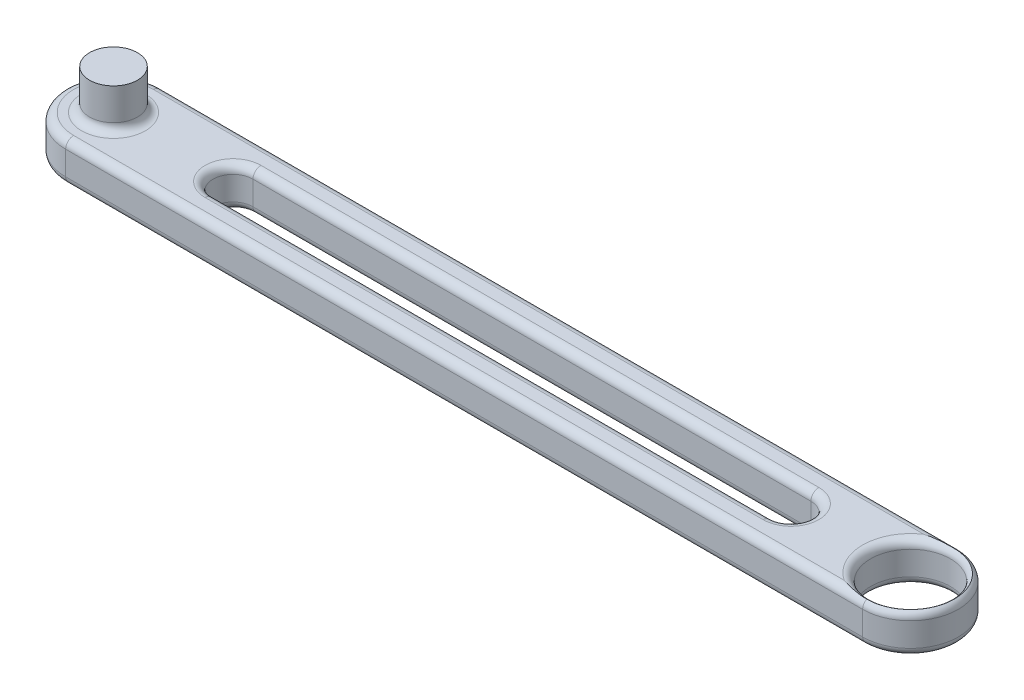
from build123d import *

# Parameters (mm, degrees)
SKETCH_1_R          = 6
EXTRUDE_1_DEPTH     = 5
EXTRUDE_1_2_DEPTH   = 5
SKETCH_3_W          = 100
SKETCH_3_H          = 12
EXTRUDE_3_DEPTH     = 5
SKETCH_5_R          = 5
CUT_EXTRUDE_2_DEPTH = 67.460514593
SKETCH_6_R          = 2.5
CUT_EXTRUDE_3_DEPTH = 67.460514593
SKETCH_7_W          = 70
SKETCH_7_H          = 5
CUT_EXTRUDE_4_DEPTH = 67.460514593
SKETCH_4_R          = 3
EXTRUDE_4_DEPTH     = 5
FILLET_1_R          = 1
FILLET_2_R          = 1


with BuildPart() as part:
    # 草图1 → 凸台-拉伸1 (new body)
    with BuildSketch(Plane(origin=(0, 0, 0), x_dir=(1, 0, 0), z_dir=(0, 1, 0))):
        with Locations(Location((-40, 0, 0), (0, 0, 270))):
            Circle(SKETCH_1_R)
    extrude(amount=EXTRUDE_1_DEPTH)



with BuildPart() as body_2:
    # 草图1 → Extrude 1 2 (new body)
    with BuildSketch(Plane(origin=(0, 0, 0), x_dir=(1, 0, 0), z_dir=(0, 1, 0))):
        with Locations(Location((60, 0, 0), (0, 0, 270))):
            Circle(SKETCH_1_R)
    extrude(amount=EXTRUDE_1_2_DEPTH)


with BuildPart() as part_1:
    add(part.part)

    add(body_2.part)  # 凸台-拉伸3 merges body 2
    # 草图3 → 凸台-拉伸3 (add)
    with BuildSketch(Plane(origin=(0, 0, 0), x_dir=(1, 0, 0), z_dir=(0, 1, 0))):
        with Locations((10, 0)):
            Rectangle(SKETCH_3_W, SKETCH_3_H)
    extrude(amount=EXTRUDE_3_DEPTH)

    # 草图5 → 切除-拉伸2 (cut, through all)
    with BuildSketch(Plane(origin=(0, 5, 0), x_dir=(1, 0, 0), z_dir=(0, 1, 0))):
        with Locations(Location((60, 0, 0), (0, 0, 270))):
            Circle(SKETCH_5_R)
    extrude(amount=-CUT_EXTRUDE_2_DEPTH, mode=Mode.SUBTRACT)

    # 草图6 → 切除-拉伸3 (cut, through all)
    with BuildSketch(Plane(origin=(0, 5, 0), x_dir=(1, 0, 0), z_dir=(0, 1, 0))):
        with Locations(Location((-25, 0, 0), (0, 0, 270))):
            Circle(SKETCH_6_R)
        with Locations(Location((45, 0, 0), (0, 0, 270))):
            Circle(SKETCH_6_R)
    extrude(amount=-CUT_EXTRUDE_3_DEPTH, mode=Mode.SUBTRACT)

    # 草图7 → 切除-拉伸4 (cut, through all)
    with BuildSketch(Plane(origin=(0, 5, 0), x_dir=(1, 0, 0), z_dir=(0, 1, 0))):
        with Locations((10, 0)):
            Rectangle(SKETCH_7_W, SKETCH_7_H)
    extrude(amount=-CUT_EXTRUDE_4_DEPTH, mode=Mode.SUBTRACT)

    # 草图4 → 凸台-拉伸4 (add)
    with BuildSketch(Plane(origin=(0, 5, 0), x_dir=(1, 0, 0), z_dir=(0, 1, 0))):
        with Locations(Location((-40, 0, 0), (0, 0, 270))):
            Circle(SKETCH_4_R)
    extrude(amount=EXTRUDE_4_DEPTH)

    # 圆角1
    fillet_1_edges = [part_1.edges().sort_by_distance(p)[0] for p in [
        (-40, 5, -3),
    ]]
    fillet(fillet_1_edges, radius=FILLET_1_R)

    # 圆角2
    # the kernel refuses this fillet: 1 mm, written as the material it takes off along each edge
    with BuildSketch(Plane(origin=(-40, 5, 0), x_dir=(0, 0, -1), z_dir=(1, 0, 0))) as fillet_2_piece_1:
        with BuildLine():
            CenterArc((6 - FILLET_2_R, -FILLET_2_R), FILLET_2_R, 0, 90)
            Line((6, -FILLET_2_R), (6, 0))
            Line((6, 0), (6 - FILLET_2_R, 0))
        make_face()
    revolve(axis=Axis((-40, 5, 0), (0, 1, 0)), revolution_arc=180, mode=Mode.SUBTRACT)
    with BuildSketch(Plane(origin=(-40, 0, -6), x_dir=(0, 1, 0), z_dir=(1, 0, 0)), Plane(origin=(-40, 5, -6), x_dir=(0, 0, 1), z_dir=(1, 0, 0)), Plane(origin=(60, 0, 6), x_dir=(0, 1, 0), z_dir=(-1, 0, 0)), Plane(origin=(60, 5, 6), x_dir=(0, 0, -1), z_dir=(-1, 0, 0))) as fillet_2_piece_2:
        with BuildLine():
            CenterArc((FILLET_2_R, FILLET_2_R), FILLET_2_R, 180, 90)
            Line((0, FILLET_2_R), (0, 0))
            Line((0, 0), (FILLET_2_R, 0))
        make_face()
    extrude(amount=100, mode=Mode.SUBTRACT)
    with BuildSketch(Plane(origin=(60, 5, 0), x_dir=(0, 0, 1), z_dir=(-1, 0, 0))) as fillet_2_piece_3:
        with BuildLine():
            CenterArc((6 - FILLET_2_R, -FILLET_2_R), FILLET_2_R, 0, 90)
            Line((6, -FILLET_2_R), (6, 0))
            Line((6, 0), (6 - FILLET_2_R, 0))
        make_face()
    revolve(axis=Axis((60, 5, 0), (0, 1, 0)), revolution_arc=180, mode=Mode.SUBTRACT)
    with BuildSketch(Plane(origin=(60, 5, 0), x_dir=(0, 0, 1), z_dir=(-1, 0, 0))) as fillet_2_piece_4:
        with BuildLine():
            CenterArc((5 + FILLET_2_R, -FILLET_2_R), FILLET_2_R, 90, 90)
            Line((5, -FILLET_2_R), (5, 0))
            Line((5, 0), (5 + FILLET_2_R, 0))
        make_face()
    revolve(axis=Axis((60, 5, 0), (0, 1, 0)), mode=Mode.SUBTRACT)
    with BuildSketch(Plane(origin=(-25, 5, 0), x_dir=(0, 0, -1), z_dir=(1, 0, 0))) as fillet_2_piece_5:
        with BuildLine():
            CenterArc((2.5 + FILLET_2_R, -FILLET_2_R), FILLET_2_R, 90, 90)
            Line((2.5, -FILLET_2_R), (2.5, 0))
            Line((2.5, 0), (2.5 + FILLET_2_R, 0))
        make_face()
    revolve(axis=Axis((-25, 5, 0), (0, 1, 0)), revolution_arc=180, mode=Mode.SUBTRACT)
    with BuildSketch(Plane(origin=(45, 5, 2.5), x_dir=(0, 0, 1), z_dir=(-1, 0, 0)), Plane(origin=(-25, 5, -2.5), x_dir=(0, 0, -1), z_dir=(1, 0, 0)), Plane(origin=(45, 0, 2.5), x_dir=(0, 1, 0), z_dir=(-1, 0, 0)), Plane(origin=(-25, 0, -2.5), x_dir=(0, 1, 0), z_dir=(1, 0, 0))) as fillet_2_piece_6:
        with BuildLine():
            CenterArc((FILLET_2_R, -FILLET_2_R), FILLET_2_R, 90, 90)
            Line((0, -FILLET_2_R), (0, 0))
            Line((0, 0), (FILLET_2_R, 0))
        make_face()
    extrude(amount=70, mode=Mode.SUBTRACT)
    with BuildSketch(Plane(origin=(45, 5, 0), x_dir=(0, 0, 1), z_dir=(-1, 0, 0))) as fillet_2_piece_7:
        with BuildLine():
            CenterArc((2.5 + FILLET_2_R, -FILLET_2_R), FILLET_2_R, 90, 90)
            Line((2.5, -FILLET_2_R), (2.5, 0))
            Line((2.5, 0), (2.5 + FILLET_2_R, 0))
        make_face()
    revolve(axis=Axis((45, 5, 0), (0, 1, 0)), revolution_arc=180, mode=Mode.SUBTRACT)
    with BuildSketch(Plane(origin=(-40, 0, 0), x_dir=(0, 0, -1), z_dir=(1, 0, 0))) as fillet_2_piece_8:
        with BuildLine():
            CenterArc((6 - FILLET_2_R, FILLET_2_R), FILLET_2_R, 270, 90)
            Line((6 - FILLET_2_R, 0), (6, 0))
            Line((6, 0), (6, FILLET_2_R))
        make_face()
    revolve(axis=Axis((-40, 0, 0), (0, 1, 0)), revolution_arc=180, mode=Mode.SUBTRACT)
    with BuildSketch(Plane(origin=(60, 0, 0), x_dir=(0, 0, 1), z_dir=(-1, 0, 0))) as fillet_2_piece_9:
        with BuildLine():
            CenterArc((6 - FILLET_2_R, FILLET_2_R), FILLET_2_R, 270, 90)
            Line((6 - FILLET_2_R, 0), (6, 0))
            Line((6, 0), (6, FILLET_2_R))
        make_face()
    revolve(axis=Axis((60, 0, 0), (0, 1, 0)), revolution_arc=180, mode=Mode.SUBTRACT)
    with BuildSketch(Plane(origin=(60, 0, 0), x_dir=(0, 0, 1), z_dir=(-1, 0, 0))) as fillet_2_piece_10:
        with BuildLine():
            CenterArc((5 + FILLET_2_R, FILLET_2_R), FILLET_2_R, 180, 90)
            Line((5 + FILLET_2_R, 0), (5, 0))
            Line((5, 0), (5, FILLET_2_R))
        make_face()
    revolve(axis=Axis((60, 0, 0), (0, 1, 0)), mode=Mode.SUBTRACT)
    with BuildSketch(Plane(origin=(-25, 0, 0), x_dir=(0, 0, -1), z_dir=(1, 0, 0))) as fillet_2_piece_11:
        with BuildLine():
            CenterArc((2.5 + FILLET_2_R, FILLET_2_R), FILLET_2_R, 180, 90)
            Line((2.5 + FILLET_2_R, 0), (2.5, 0))
            Line((2.5, 0), (2.5, FILLET_2_R))
        make_face()
    revolve(axis=Axis((-25, 0, 0), (0, 1, 0)), revolution_arc=180, mode=Mode.SUBTRACT)
    with BuildSketch(Plane(origin=(45, 0, 0), x_dir=(0, 0, 1), z_dir=(-1, 0, 0))) as fillet_2_piece_12:
        with BuildLine():
            CenterArc((2.5 + FILLET_2_R, FILLET_2_R), FILLET_2_R, 180, 90)
            Line((2.5 + FILLET_2_R, 0), (2.5, 0))
            Line((2.5, 0), (2.5, FILLET_2_R))
        make_face()
    revolve(axis=Axis((45, 0, 0), (0, 1, 0)), revolution_arc=180, mode=Mode.SUBTRACT)


solid = part_1.part
